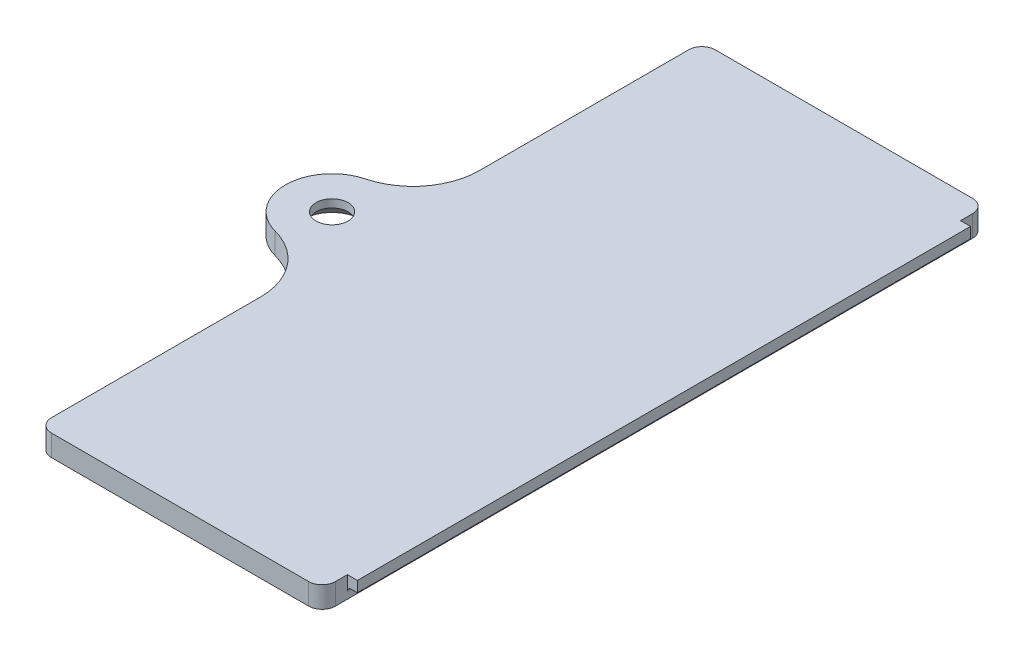
from build123d import *

# Parameters (mm, degrees)
DOOR_PLATE_1_6_SCREW_EAR_R5_R3_5_DEPTH        = 1.6
HOOK_FLANGE_0_75_X_0_8_INNER_FACE_P_2_W       = 0.9
HOOK_FLANGE_0_75_X_0_8_INNER_FACE_P_2_H       = 46
HOOK_FLANGE_0_75_X_0_8_INNER_FACE_PLANE_DEPTH = 0.8
SCREW_HOLE_2_4_FREE_SKETCH_R                  = 1.2
SCREW_HOLE_2_4_FREE_DEPTH                     = 73.114700304
SCREW_CSK_90DEG_M2_SIZE                       = 1
DOOR_CORNERS_R1_PRINT_R                       = 1
HOOK_FLANGE_ROOT_FILLET_R0_3_R                = 0.3


with BuildPart() as part:
    # Door Plate 1.6 + screw ear (R5 / R3.5) Sketch → Door Plate 1.6 + screw ear (R5 / R3.5) (new body)
    with BuildSketch(Plane(origin=(0, 0, 0), x_dir=(1, 0, 0), z_dir=(0, 1, 0))):
        with BuildLine():
            Line((9.35, 15.1), (30.65, 15.1))
            Line((30.65, 15.1), (30.65, 64.9))
            Line((30.65, 64.9), (9.35, 64.9))
            Line((9.35, 64.9), (9.35, 48.223594105))
            ThreePointArc((9.35, 48.223594105), (8.307494751, 45.167741475), (5.614705882, 43.386185808))
            ThreePointArc((5.614705882, 43.386185808), (3, 40), (5.614705882, 36.613814192))
            ThreePointArc((5.614705882, 36.613814192), (8.307494751, 34.832258525), (9.35, 31.776405895))
            Line((9.35, 31.776405895), (9.35, 15.1))
        make_face()
    extrude(amount=DOOR_PLATE_1_6_SCREW_EAR_R5_R3_5_DEPTH)

    # Hook Flange 0.75 x 0.8 _inner-face p 2 → Hook Flange 0.75 x 0.8 _inner-face plane (add)
    with BuildSketch(Plane(origin=(0, 0.8, 0), x_dir=(1, 0, 0), z_dir=(0, 1, 0))):
        with Locations((30.95, 40)):
            Rectangle(HOOK_FLANGE_0_75_X_0_8_INNER_FACE_P_2_W, HOOK_FLANGE_0_75_X_0_8_INNER_FACE_P_2_H)
    extrude(amount=HOOK_FLANGE_0_75_X_0_8_INNER_FACE_PLANE_DEPTH)

    # Screw Hole 2.4 (free) Sketch → Screw Hole 2.4 (free) (cut, through all)
    with BuildSketch(Plane(origin=(0, 0, 0), x_dir=(1, 0, 0), z_dir=(0, 1, 0))):
        with Locations((6.5, 40)):
            Circle(SCREW_HOLE_2_4_FREE_SKETCH_R)
    extrude(amount=SCREW_HOLE_2_4_FREE_DEPTH, mode=Mode.SUBTRACT)

    # Screw CSK 90deg (M2)
    screw_csk_90deg_m2_edges = [part.edges().sort_by_distance(p)[0] for p in [
        (5.3, 0, -40),
    ]]
    chamfer(screw_csk_90deg_m2_edges, length=SCREW_CSK_90DEG_M2_SIZE)

    # Door Corners R1 (print)
    door_corners_r1_print_edges = [part.edges().sort_by_distance(p)[0] for p in [
        (9.35, 0.8, -64.9),
        (30.65, 0.8, -64.9),
        (30.65, 0.8, -15.1),
        (9.35, 0.8, -15.1),
    ]]
    fillet(door_corners_r1_print_edges, radius=DOOR_CORNERS_R1_PRINT_R)

    # Hook Flange Root Fillet R0.3
    hook_flange_root_fillet_r0_3_edges = [part.edges().sort_by_distance(p)[0] for p in [
        (30.65, 0.8, -40),
    ]]
    fillet(hook_flange_root_fillet_r0_3_edges, radius=HOOK_FLANGE_ROOT_FILLET_R0_3_R)


solid = part.part
